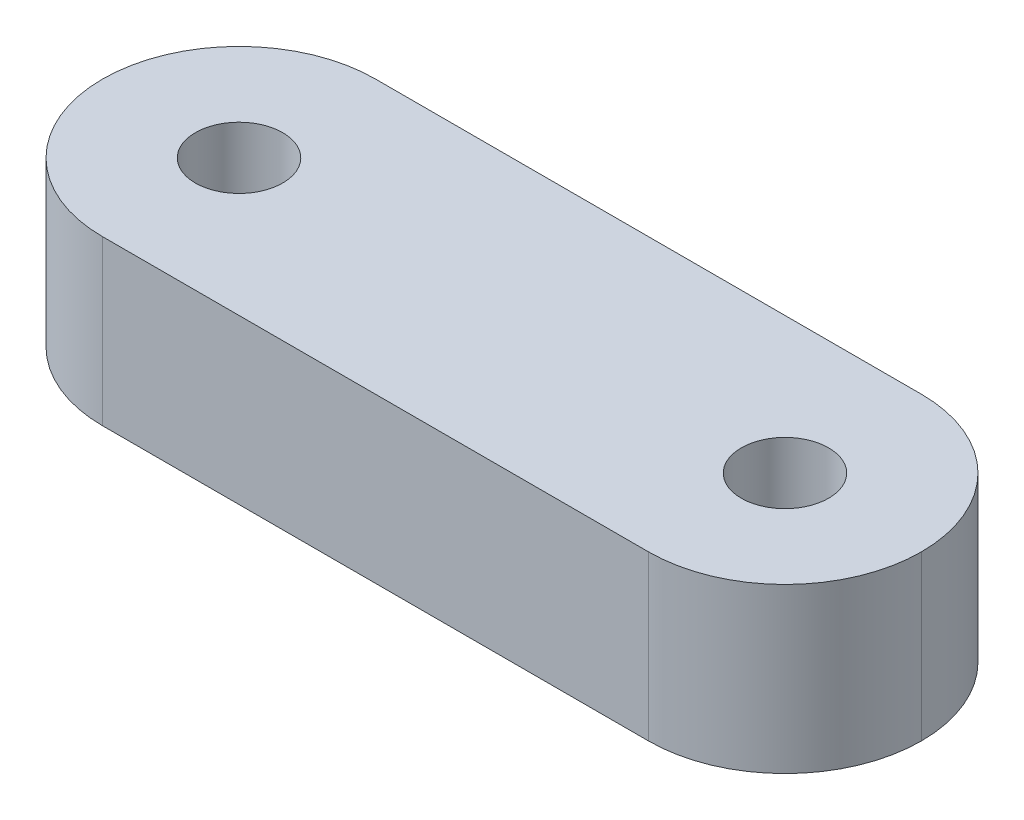
from build123d import *

# Parameters (mm, degrees)
SKETCH2_W            = 30
SKETCH2_H            = 10
BOSS_EXTRUDE1_DEPTH  = 6
M3_CLEARANCE_HOLE1_D = 3.2
FILLET1_R            = 5


with BuildPart() as part:
    # Sketch2 → Boss-Extrude1 (new body)
    with BuildSketch(Plane(origin=(0, 0, 0), x_dir=(1, 0, 0), z_dir=(0, 1, 0))):
        Rectangle(SKETCH2_W, SKETCH2_H)
    extrude(amount=BOSS_EXTRUDE1_DEPTH)

    # M3 Clearance Hole1 (through all)
    with Locations(Plane(origin=(0, 6, 0), x_dir=(1, 0, 0), z_dir=(0, 1, 0))):
        with Locations((-10, 0), (10, 0)):
            Hole(M3_CLEARANCE_HOLE1_D / 2)

    # Fillet1
    fillet1_edges = [part.edges().sort_by_distance(p)[0] for p in [
        (15, 3, -5),
        (15, 3, 5),
        (-15, 3, 5),
        (-15, 3, -5),
    ]]
    fillet(fillet1_edges, radius=FILLET1_R - 0.0001)  # a hair under: the kernel refuses the full size


solid = part.part
